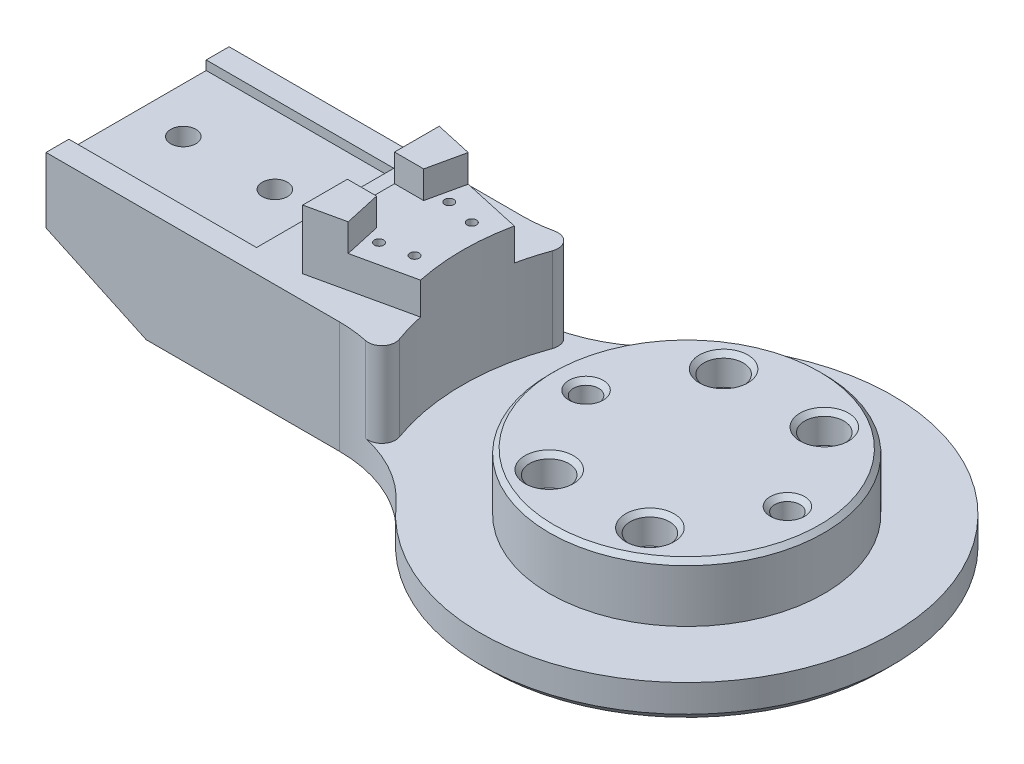
from build123d import *

# Parameters (mm, degrees)
SKETCH1_R           = 30
BOSS_EXTRUDE1_DEPTH = 12.5
SKETCH3_R           = 45.00000000000001
BOSS_EXTRUDE3_DEPTH = 8
SKETCH17_R          = 2.7499999999999982
CUT_EXTRUDE9_DEPTH  = 6
SKETCH19_R          = 4.3
SKETCH19_R_2        = 4.299999999999999
CUT_EXTRUDE12_DEPTH = 6.5
BOSS_EXTRUDE5_START = -8
BOSS_EXTRUDE5_DEPTH = 8
BOSS_EXTRUDE6_DEPTH = 18.5
FILLET1_R           = 30
CUT_EXTRUDE14_DEPTH = 41
SKETCH26_R          = 2.750000000000008
CUT_EXTRUDE15_DEPTH = 131.87111980876452
CUT_EXTRUDE16_DEPTH = 12
BOSS_EXTRUDE7_DEPTH = 13
CUT_EXTRUDE21_DEPTH = 6
SKETCH34_R          = 0.9999999999999991
SKETCH34_R_2        = 0.9999999999999933
SKETCH34_R_3        = 0.9999999999999983
SKETCH34_R_4        = 0.9999999999999981
CUT_EXTRUDE22_DEPTH = 5
CHAMFER4_SIZE       = 1
CHAMFER5_SIZE       = 1
SKETCH35_R          = 4.599999999999999
CUT_EXTRUDE23_DEPTH = 15
FILLET3_R           = 3
CHAMFER6_SIZE       = 21.445069205
CHAMFER6_SIZE_2     = 10
CHAMFER7_SIZE       = 2
CHAMFER8_SIZE       = 1
SKETCH37_W          = 12.834846050171066
SKETCH37_H          = 29.012722943474188
CUT_EXTRUDE24_DEPTH = 15


with BuildPart() as part:
    # Sketch1 → Boss-Extrude1 (new body)
    with BuildSketch(Plane(origin=(0, 0, 0), x_dir=(1, 0, 0), z_dir=(0, 1, 0))):
        with Locations(Location((0, 0, 0), (0, 0, 270))):
            Circle(SKETCH1_R)
    extrude(amount=BOSS_EXTRUDE1_DEPTH)

    # Sketch3 → Boss-Extrude3 (add)
    with BuildSketch(Plane.XZ):
        with Locations(Location((0, 0, 0), (0, 0, 270))):
            Circle(SKETCH3_R)
    extrude(amount=BOSS_EXTRUDE3_DEPTH)

    # Sketch17 → Cut-Extrude9 (cut)
    with BuildSketch(Plane(origin=(0, 12.5, 0), x_dir=(1, 0, 0), z_dir=(0, 1, 0))):
        with Locations(Location((22, 2.69e-15, 0), (0, 0, 270))):
            Circle(SKETCH17_R)
        with Locations(Location((-22, 0, 0), (0, 0, 270))):
            Circle(SKETCH17_R)
    extrude(amount=-CUT_EXTRUDE9_DEPTH, mode=Mode.SUBTRACT)

    # Sketch19 → Cut-Extrude12 (cut)
    with BuildSketch(Plane(origin=(0, 12.5, 0), x_dir=(1, 0, 0), z_dir=(0, 1, 0))):
        with Locations(Location((-10.999999999999986, -19.05255888325766, 0), (0, 0, 270))):
            Circle(SKETCH19_R)
        with Locations(Location((11.00000000000001, -19.05255888325765, 0), (0, 0, 270))):
            Circle(SKETCH19_R_2)
        with Locations(Location((10.999999999999993, 19.052558883257653, 0), (0, 0, 270))):
            Circle(SKETCH19_R_2)
        with Locations(Location((-11.000000000000007, 19.05255888325765, 0), (0, 0, 270))):
            Circle(SKETCH19_R)
    extrude(amount=-CUT_EXTRUDE12_DEPTH, mode=Mode.SUBTRACT)

    # Sketch22 → Boss-Extrude5 (add)
    with BuildSketch(Plane.XZ.offset(8).offset(BOSS_EXTRUDE5_START)):
        with BuildLine():
            Line((-40.31128874149275, 20), (-120, 19.999999999999993))
            Line((-120, 19.999999999999993), (-120, -20.000000000000007))
            Line((-120, -20.000000000000007), (-40.31128874149276, -20))
            ThreePointArc((-40.31128874149276, -20), (-45.00000000000001, 5.51e-15), (-40.31128874149275, 20))
        make_face()
    extrude(amount=BOSS_EXTRUDE5_DEPTH)

    # Sketch24 → Boss-Extrude6 (add)
    with BuildSketch(Plane(origin=(0, 0, 0), x_dir=(1, 0, 0), z_dir=(0, 1, 0))):
        with BuildLine():
            Line((-120, -20), (-44.73253849269008, -20))
            ThreePointArc((-44.73253849269008, -20), (-49, 6e-15), (-44.73253849269009, 19.999999999999986))
            Line((-44.73253849269009, 19.999999999999986), (-120, 20))
            Line((-120, 20), (-120, -20))
        make_face()
    extrude(amount=BOSS_EXTRUDE6_DEPTH)

    # Fillet1
    # the kernel refuses this fillet: 30 mm, written as the material it adds along each edge
    with BuildSketch(Plane(origin=(-40.31128874149275, 38.97602674000499, -20.000000000000004), x_dir=(0.5606253720867512, 0, -0.8280695575690438), z_dir=(0, -1, 0))) as fillet1_piece_1_section:
        with BuildLine():
            CenterArc((16.10170692963991, -29.728705649960602), FILLET1_R, 97.7112574672678, 48.1896851042214)
            Line((-8.740379797431398, -12.90994448735806), (0, 0))
            ThreePointArc((0, 0), (6.038140098614967, -0.4069415250591067), (12.076280197229933, 2.1e-16))
        make_face()
    fillet1_piece_1 = extrude(amount=46.97602674000499, mode=Mode.PRIVATE)
    fillet1_piece_1 = split(fillet1_piece_1, bisect_by=Plane(origin=(-48.427696817915454, 0, -20.33565433426988), z_dir=(0, 1, 0)), keep=Keep.TOP, mode=Mode.PRIVATE)
    fillet1_piece_1 = fillet1_piece_1 - Plane(origin=(8.882e-14, 9.24999999999995, -1.78e-15), x_dir=(-0.9129089488304102, 0, 0.4081632653061218), z_dir=(0, -1, 0)) * Cylinder(49.00000000000008, 146, mode=Mode.PRIVATE)
    fillet1_piece_1 = split(fillet1_piece_1, bisect_by=Plane(origin=(-48.427696817915454, 18.5, -20.33565433426988), z_dir=(0, -1, 0)), keep=Keep.TOP, mode=Mode.PRIVATE)
    add(fillet1_piece_1)
    with BuildSketch(Plane(origin=(-40.31128874149276, 0, -20), x_dir=(0.5606253720867515, 0, -0.8280695575690435), z_dir=(0, -1, 0))) as fillet1_piece_2_section:
        with BuildLine():
            CenterArc((16.101706929639906, -29.728705649960602), FILLET1_R, 97.71125746726779, 48.18968510422141)
            Line((-8.740379797431395, -12.909944487358054), (0, 0))
            ThreePointArc((0, 0), (6.038140098614973, -0.4069415250591045), (12.076280197229938, 4.4e-16))
        make_face()
    fillet1_piece_2 = extrude(amount=8, mode=Mode.PRIVATE)
    fillet1_piece_2 = fillet1_piece_2 & Plane(origin=(8.882e-14, -4, -1.78e-15), x_dir=(-0.9129089488304102, 0, 0.4081632653061218), z_dir=(0, -1, 0)) * Cylinder(49.00000000000008, 68, mode=Mode.PRIVATE)
    add(fillet1_piece_2)
    with BuildSketch(Plane(origin=(-40.31128874149276, 0, -20), x_dir=(0.5606253720867515, 0, -0.8280695575690435), z_dir=(0, -1, 0))) as fillet1_piece_3_section:
        with BuildLine():
            CenterArc((16.101706929639906, -29.728705649960602), FILLET1_R, 97.71125746726779, 48.18968510422141)
            Line((-8.740379797431395, -12.909944487358054), (0, 0))
            ThreePointArc((0, 0), (6.038140098614973, -0.4069415250591045), (12.076280197229938, 4.4e-16))
        make_face()
    fillet1_piece_3 = extrude(amount=8, mode=Mode.PRIVATE)
    fillet1_piece_3 = fillet1_piece_3 - Plane(origin=(8.882e-14, -4, -1.78e-15), x_dir=(-0.9129089488304102, 0, 0.4081632653061218), z_dir=(0, -1, 0)) * Cylinder(49.00000000000008, 68, mode=Mode.PRIVATE)
    add(fillet1_piece_3)
    with BuildSketch(Plane(origin=(-40.31128874149275, 38.97602674000499, 20), x_dir=(0.5606253720867513, 0, 0.8280695575690437), z_dir=(0, -1, 0))) as fillet1_piece_4_section:
        with BuildLine():
            CenterArc((16.10170692963994, 29.7287056499606), FILLET1_R, 214.09905742851078, 48.18968510422144)
            Line((-8.740379797431375, 12.909944487358066), (0, 0))
            ThreePointArc((0, 0), (6.0381400986150044, 0.4069415250591079), (12.076280197229954, 2e-16))
        make_face()
    fillet1_piece_4 = extrude(amount=46.97602674000499, mode=Mode.PRIVATE)
    fillet1_piece_4 = split(fillet1_piece_4, bisect_by=Plane(origin=(-48.42769681791544, 0, 20.335654334269947), z_dir=(0, 1, 0)), keep=Keep.TOP, mode=Mode.PRIVATE)
    fillet1_piece_4 = split(fillet1_piece_4, bisect_by=Plane(origin=(-48.42769681791544, 18.5, 20.335654334269947), z_dir=(0, -1, 0)), keep=Keep.TOP, mode=Mode.PRIVATE)
    fillet1_piece_4 = fillet1_piece_4 - Plane(origin=(8.882e-14, 9.250000000000002, -1.78e-15), x_dir=(-0.9129089488304102, 0, 0.4081632653061218), z_dir=(0, -1, 0)) * Cylinder(49.00000000000008, 146, mode=Mode.PRIVATE)
    add(fillet1_piece_4)
    with BuildSketch(Plane(origin=(-40.31128874149275, 0, 20.000000000000004), x_dir=(0.5606253720867515, 0, 0.8280695575690435), z_dir=(0, -1, 0))) as fillet1_piece_5_section:
        with BuildLine():
            CenterArc((16.10170692963993, 29.728705649960602), FILLET1_R, 214.0990574285108, 48.18968510422138)
            Line((-8.74037979743138, 12.909944487358063), (0, 0))
            ThreePointArc((0, 0), (6.038140098615002, 0.4069415250591069), (12.07628019722995, 2.1e-16))
        make_face()
    fillet1_piece_5 = extrude(amount=8, mode=Mode.PRIVATE)
    fillet1_piece_5 = fillet1_piece_5 & Plane(origin=(8.882e-14, -4, -1.78e-15), x_dir=(-0.9129089488304102, 0, 0.4081632653061218), z_dir=(0, -1, 0)) * Cylinder(49.00000000000008, 68, mode=Mode.PRIVATE)
    add(fillet1_piece_5)
    with BuildSketch(Plane(origin=(-40.31128874149275, 0, 20.000000000000004), x_dir=(0.5606253720867515, 0, 0.8280695575690435), z_dir=(0, -1, 0))) as fillet1_piece_6_section:
        with BuildLine():
            CenterArc((16.10170692963993, 29.728705649960602), FILLET1_R, 214.0990574285108, 48.18968510422138)
            Line((-8.74037979743138, 12.909944487358063), (0, 0))
            ThreePointArc((0, 0), (6.038140098615002, 0.4069415250591069), (12.07628019722995, 2.1e-16))
        make_face()
    fillet1_piece_6 = extrude(amount=8, mode=Mode.PRIVATE)
    fillet1_piece_6 = fillet1_piece_6 - Plane(origin=(8.882e-14, -3.9999999999999996, -1.78e-15), x_dir=(-0.9129089488304102, 0, 0.4081632653061218), z_dir=(0, -1, 0)) * Cylinder(49.00000000000008, 68, mode=Mode.PRIVATE)
    add(fillet1_piece_6)

    # Sketch25 → Cut-Extrude14 (cut)
    with BuildSketch(Plane.ZY.offset(120)):
        Polygon((-15, 20.5), (14.999999999999998, 20.500000000000004), (15, 16.5), (-15, 16.5), align=None)
    extrude(amount=-CUT_EXTRUDE14_DEPTH, mode=Mode.SUBTRACT)

    # Sketch26 → Cut-Extrude15 (cut, through all)
    with BuildSketch(Plane.XZ.offset(8)):
        with Locations(Location((-110, 0, 0), (0, 0, 270))):
            Circle(SKETCH26_R)
        with Locations(Location((-90, 0, 0), (0, 0, 270))):
            Circle(SKETCH26_R)
    extrude(amount=-CUT_EXTRUDE15_DEPTH, mode=Mode.SUBTRACT)

    # Sketch27 → Cut-Extrude16 (cut)
    with BuildSketch(Plane.XZ.offset(8)):
        Polygon((-94.73334878284524, -0.09350204955340616), (-92.28569924120347, -4.14595131569283), (-87.55235045835822, -4.052449266139432), (-85.26665121715473, 0.09350204955341612), (-87.71430075879651, 4.145951315692857), (-92.44764954164177, 4.052449266139459), align=None)
        Polygon((-114.73334878284524, -0.09350204955339836), (-112.28569924120346, -4.14595131569285), (-107.55235045835823, -4.052449266139453), (-105.26665121715476, 0.09350204955340193), (-107.71430075879653, 4.145951315692842), (-112.44764954164177, 4.052449266139446), align=None)
    extrude(amount=-CUT_EXTRUDE16_DEPTH, mode=Mode.SUBTRACT)

    # Sketch31 → Boss-Extrude7 (add)
    with BuildSketch(Plane(origin=(0, 18.5, 0), x_dir=(1, 0, 0), z_dir=(0, 1, 0))):
        with BuildLine():
            Line((-69, -1.73e-15), (-49, -6e-17))
            ThreePointArc((-49, -1.78e-15), (-48.72861661672606, 5.149943943396856), (-47.91747254611715, 10.242842612874112))
            Line((-47.91747254611715, 10.242842612874112), (-69, 14.916726424423207))
            Line((-69, 14.916726424423207), (-69, -1.78e-15))
        make_face()
        with BuildLine():
            ThreePointArc((-47.91747254611714, -10.242842612874123), (-48.72861661672604, -5.149943943396865), (-49, -1.78e-15))
            Line((-49, -6e-17), (-69, -1.73e-15))
            Line((-69, -1.78e-15), (-69, -14.91672642442321))
            Line((-69, -14.91672642442321), (-47.917472546117146, -10.242842612874112))
        make_face()
    extrude(amount=BOSS_EXTRUDE7_DEPTH)

    # Sketch33 → Cut-Extrude21 (cut)
    with BuildSketch(Plane(origin=(0, 31.5, 0), x_dir=(1, 0, 0), z_dir=(0, 1, 0))):
        Polygon((-47.872191811225676, -10.232804115628124), (-60.856928705920794, -13.111450981004902), (-62.6227554893575, -5.146321092962614), (-69, -5.1463210929626175), (-69, 5.146321092962605), (-62.6227554893575, 5.1463210929626175), (-60.856928705920794, 13.111450981004895), (-47.872191811225676, 10.23280411562812), (-49.483408051793795, 2.9650773180589796), (-49.483408051793795, -2.965077318058979), align=None)
    extrude(amount=-CUT_EXTRUDE21_DEPTH, mode=Mode.SUBTRACT)

    # Sketch34 → Cut-Extrude22 (cut)
    with BuildSketch(Plane(origin=(0, 25.500000000000004, 0), x_dir=(1, 0, 0), z_dir=(0, 1, 0))):
        with Locations(Location((-53.219119349326604, -6.25658623597791, 0), (0, 0, 90))):
            Circle(SKETCH34_R)
        with Locations(Location((-59.56331832475562, -7.67120256564663, 0), (0, 0, 90))):
            Circle(SKETCH34_R_2)
        with Locations(Location((-59.563318324755585, 7.671202565646677, 0), (0, 0, 270))):
            Circle(SKETCH34_R_3)
        with Locations(Location((-53.219119349326576, 6.256586235977926, 0), (0, 0, 270))):
            Circle(SKETCH34_R_4)
    extrude(amount=-CUT_EXTRUDE22_DEPTH, mode=Mode.SUBTRACT)

    # Chamfer4
    chamfer4_edges = [part.edges().sort_by_distance(p)[0] for p in [
        (2.251e-14, 12.5, -30),
    ]]
    chamfer(chamfer4_edges, length=CHAMFER4_SIZE)

    # Chamfer5
    chamfer5_edges = [part.edges().sort_by_distance(p)[0] for p in [
        (22.000000000000004, 12.5, -2.750000000000001),
        (-21.999999999999996, 12.5, -2.7499999999999982),
        (-11.000000000000005, 12.5, -23.35255888325765),
        (10.999999999999995, 12.5, -23.35255888325765),
        (11.000000000000012, 12.5, 14.75255888325765),
        (-10.999999999999984, 12.5, 14.75255888325766),
    ]]
    chamfer(chamfer5_edges, length=CHAMFER5_SIZE)

    # Sketch35 → Cut-Extrude23 (cut)
    with BuildSketch(Plane.XZ.offset(8)):
        with Locations(Location((-22, 0, 0), (0, 0, 270))):
            Circle(SKETCH35_R)
        with Locations(Location((22, -2.69e-15, 0), (0, 0, 270))):
            Circle(SKETCH35_R)
    extrude(amount=-CUT_EXTRUDE23_DEPTH, mode=Mode.SUBTRACT)

    # Fillet3
    fillet3_edges = [part.edges().sort_by_distance(p)[0] for p in [
        (-43.41261753423428, 9.25, -22.723218056126946),
        (-43.41261753423428, 9.25, 22.723218056126946),
    ]]
    fillet(fillet3_edges, radius=FILLET3_R)

    # Chamfer6
    # the kernel refuses this chamfer: 21.445069205, 10 mm, written as the material it takes off along each edge
    with BuildSketch(Plane(origin=(-120, -8, 75.56364829338284), x_dir=(0.9998669641130703, -0.01631116413111024, 0), z_dir=(0, 0, -1))) as chamfer6_piece_1:
        Polygon((CHAMFER6_SIZE * 0.999866964118, -CHAMFER6_SIZE * 0.0163111641312), (-CHAMFER6_SIZE_2 * 0.0163111641311, -CHAMFER6_SIZE_2 * 0.999866964113), (0, 0), align=None)
    extrude(amount=151.12729658676568, mode=Mode.SUBTRACT)

    # Chamfer7
    chamfer7_edges = [part.edges().sort_by_distance(p)[0] for p in [
        (-77.22831511619461, -8, -20.000000000000004),
        (-109.27746539744713, -2.9999999999993143, -20.000000000000018),
        (-109.27746539744714, -2.9999999999993143, 19.999999999999982),
        (45.00000000000001, -8, 3.55e-15),
        (-77.22831511619461, -8, 19.999999999999996),
        (-43.654250723578656, -8, -22.61387212474282),
        (-43.65425072357866, -8, 22.613872124742816),
    ]]
    chamfer(chamfer7_edges, length=CHAMFER7_SIZE)

    # Chamfer8
    chamfer8_edges = [part.edges().sort_by_distance(p)[0] for p in [
        (-22, -8, 4.599999999999999),
        (22, -8, 4.599999999999996),
    ]]
    chamfer(chamfer8_edges, length=CHAMFER8_SIZE)

    # Sketch37 → Cut-Extrude24 (cut)
    with BuildSketch(Plane(origin=(0, 25.500000000000004, 0), x_dir=(1, 0, 0), z_dir=(0, 1, 0))):
        with Locations((-49, 5.33e-15)):
            Rectangle(SKETCH37_W, SKETCH37_H)
    extrude(amount=CUT_EXTRUDE24_DEPTH, mode=Mode.SUBTRACT)


solid = part.part
